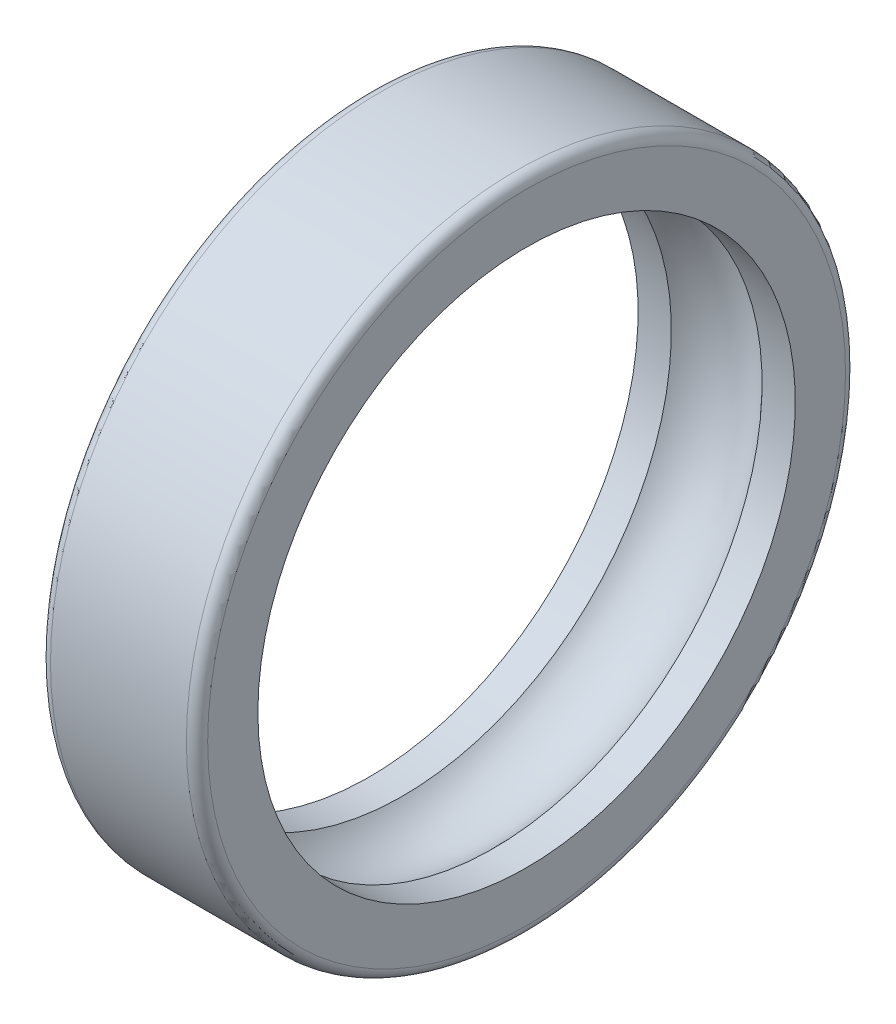
from build123d import *

# Parameters (mm, degrees)
FILLET1_R    = 2.1
SCALE1_SCALE = 0.193040386


with BuildPart() as part:
    # Sketch1 → Revolve1 (revolve)
    with BuildSketch(Plane.XY):
        with BuildLine():
            Line((-15.5, 65), (15.5, 65))
            Line((15.5, 65), (15.5, 53))
            Line((15.5, 53), (8.94427191, 53))
            ThreePointArc((8.94427191, 53), (0, 57), (-8.94427191, 53))
            Line((-8.94427191, 53), (-15.5, 53))
            Line((-15.5, 53), (-15.5, 65))
        make_face()
    revolve(axis=Axis((-25.358454362, 0, 0), (1, 0, 0)))

    # Fillet1
    fillet1_edges = [part.edges().sort_by_distance(p)[0] for p in [
        (15.5, -65, 0),
        (-15.5, -65, 0),
    ]]
    fillet(fillet1_edges, radius=FILLET1_R)


with BuildPart() as part_1:
    # Scale1: scaled about (0, 0, 0)
    add(part.part.scale(SCALE1_SCALE))


solid = part_1.part
